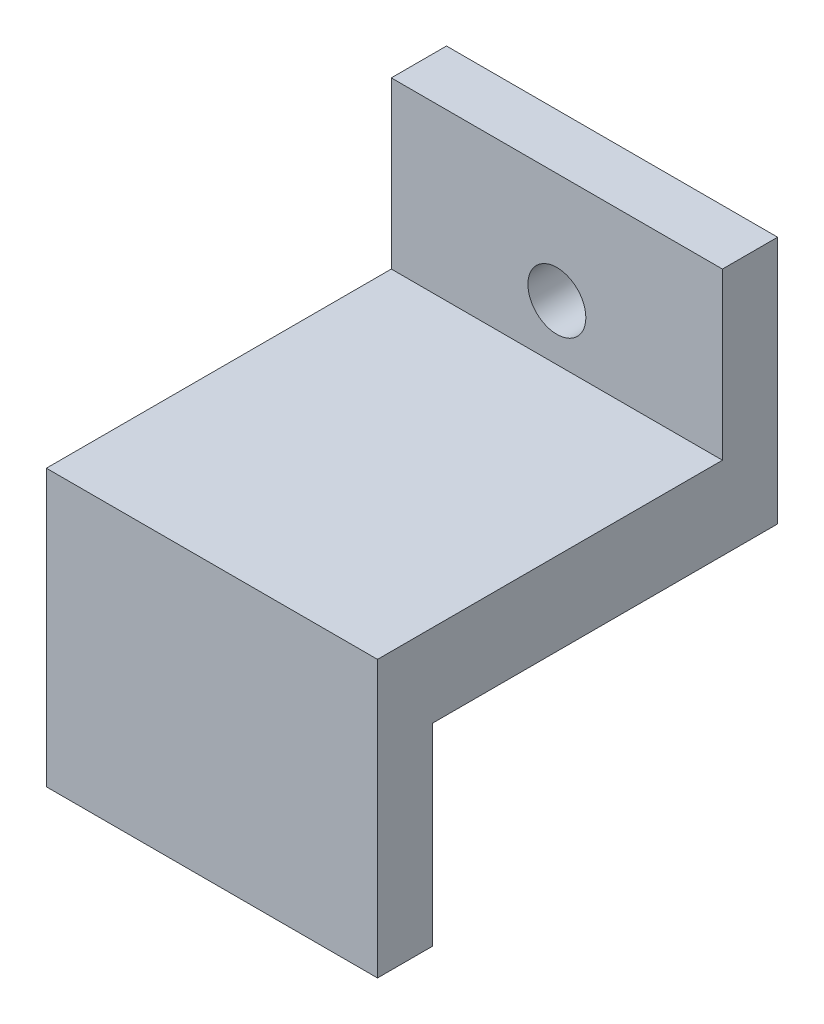
from build123d import *

# Parameters (mm, degrees)
LINK_EYE_SHELF_START          = -14.5
SKETCH1_W                     = 12
SKETCH1_H                     = 9
SKETCH1_R                     = 1.05
LINK_EYE_SHELF_DEPTH          = 2
OUTBOARD_WEB_START            = -13.5
SKETCH2_W                     = 12
SKETCH2_H                     = 3
OUTBOARD_WEB_DEPTH            = 12.5
INTERMEDIATE_PLATE_FOOT_START = -2
SKETCH3_W                     = 12
SKETCH3_H                     = 10
INTERMEDIATE_PLATE_FOOT_DEPTH = 2


with BuildPart() as part:
    # Sketch1 → Link_Eye_Shelf (new body)
    with BuildSketch(Plane.XY.offset(LINK_EYE_SHELF_START)):
        with Locations((-20, 35.5)):
            Rectangle(SKETCH1_W, SKETCH1_H)
        with Locations((-20, 36)):
            Circle(SKETCH1_R, mode=Mode.SUBTRACT)
    extrude(amount=LINK_EYE_SHELF_DEPTH)

    # Sketch2 → Outboard_Web (add)
    with BuildSketch(Plane.XY.offset(OUTBOARD_WEB_START)):
        with Locations((-20, 32.5)):
            Rectangle(SKETCH2_W, SKETCH2_H)
    extrude(amount=OUTBOARD_WEB_DEPTH)

    # Sketch3 → Intermediate_Plate_Foot (add)
    with BuildSketch(Plane.XY.offset(INTERMEDIATE_PLATE_FOOT_START)):
        with Locations((-20, 29)):
            Rectangle(SKETCH3_W, SKETCH3_H)
    extrude(amount=INTERMEDIATE_PLATE_FOOT_DEPTH)


solid = part.part
